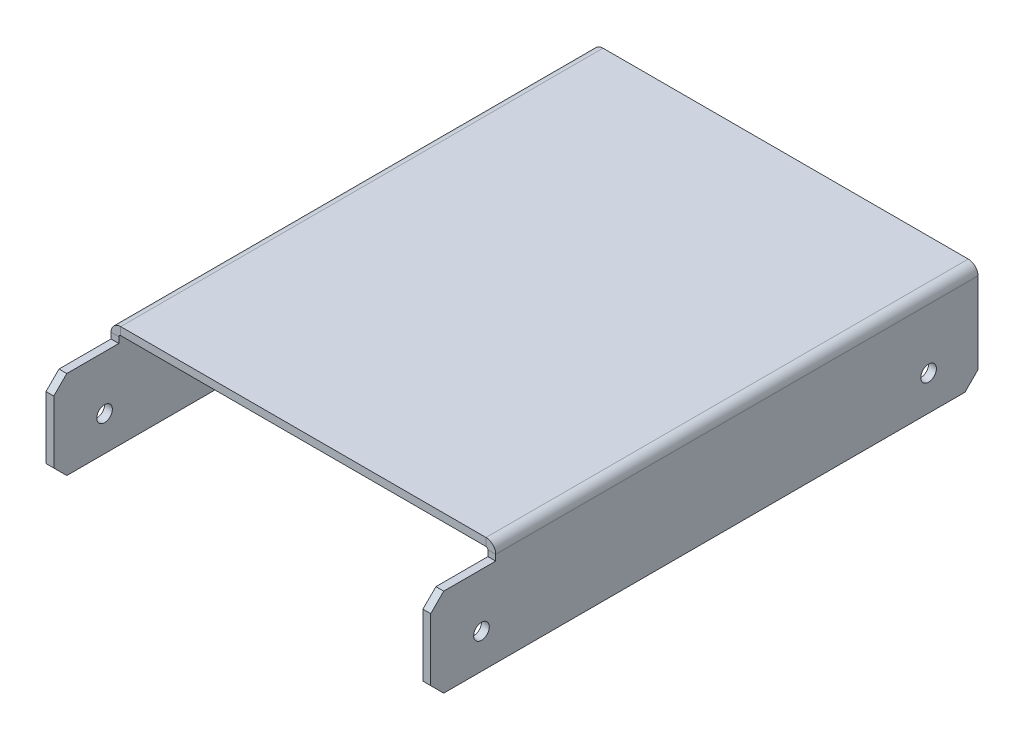
from build123d import *

# Parameters (mm, degrees)
SKETCH18_W                     = 148
SKETCH18_H                     = 205.5334
BASE_FLANGE1_DEPTH             = 3
EDGE_FLANGE1_STRIP_W           = 13.4732
EDGE_FLANGE1_STRIP_H           = 3
EDGE_FLANGE1_STRIP_CUT_DEPTH   = 205.5334
EDGE_FLANGE1_STRIP_2_W         = 13.4732
EDGE_FLANGE1_STRIP_2_H         = 3
EDGE_FLANGE1_STRIP_CUT_2_DEPTH = 205.5334
EDGE_FLANGE1_DEPTH             = 205.5334
EDGE_FLANGE1_BEND_DEPTH        = 205.5334
SKETCH27_R                     = 3
CUT_EXTRUDE1_DEPTH             = 227.212201998
SKETCH28_W                     = 160
SKETCH28_H                     = 8
CUT_EXTRUDE2_DEPTH             = 25
BOSS_EXTRUDE1_DEPTH            = 5
CHAMFER2_SIZE                  = 5


# Sheet-metal steps are written as plain solids
with BuildPart() as part:
    # Sketch18 → Base-Flange1 (new body)
    with BuildSketch(Plane(origin=(0, 0, 0), x_dir=(1, 0, 0), z_dir=(0, 1, 0))):
        with Locations((-74, -63.57018807)):
            Rectangle(SKETCH18_W, SKETCH18_H)
    extrude(amount=-BASE_FLANGE1_DEPTH)

    # Edge-Flange1 strip (across the edge) → Edge-Flange1 strip cut (cut)
    with BuildSketch(Plane(origin=(0, -3, -39.19651193), x_dir=(-1, 0, 0), z_dir=(0, 0, 1))):
        with Locations((-3, -1.5)):
            Rectangle(EDGE_FLANGE1_STRIP_W, EDGE_FLANGE1_STRIP_H)
    extrude(amount=EDGE_FLANGE1_STRIP_CUT_DEPTH, mode=Mode.SUBTRACT)

    # Edge-Flange1 strip 2 (across the edge) → Edge-Flange1 strip cut 2 (cut)
    with BuildSketch(Plane(origin=(-148, -3, 166.33688807), x_dir=(1, 0, 0), z_dir=(0, 0, -1))):
        with Locations((-3, -1.5)):
            Rectangle(EDGE_FLANGE1_STRIP_2_W, EDGE_FLANGE1_STRIP_2_H)
    extrude(amount=EDGE_FLANGE1_STRIP_CUT_2_DEPTH, mode=Mode.SUBTRACT)

    # Edge-Flange1 section (across the edge) → Edge-Flange1 (add)
    with BuildSketch(Plane(origin=(0, -3, -39.19651193), x_dir=(-1, 0, 0), z_dir=(0, 0, 1))):
        with BuildLine():
            Line((0, 0.7366), (0, 37))
            Line((0, 37), (3, 37))
            Line((3, 37), (3, 0.7366))
            ThreePointArc((3, 0.7366), (3.215745145, 0.215745145), (3.7366, 0))
            Line((3.7366, 0), (3.7366, -3))
            ThreePointArc((3.7366, -3), (1.094424801, -1.905575199), (0, 0.7366))
        make_face()
    extrude(amount=EDGE_FLANGE1_DEPTH)

    # Edge-Flange1 section 2 (across the edge) → Edge-Flange1 bend (add)
    with BuildSketch(Plane(origin=(-148, -3, 166.33688807), x_dir=(1, 0, 0), z_dir=(0, 0, -1))):
        with BuildLine():
            Line((0, 0.7366), (0, 37))
            Line((0, 37), (3, 37))
            Line((3, 37), (3, 0.7366))
            ThreePointArc((3, 0.7366), (3.215745145, 0.215745145), (3.7366, 0))
            Line((3.7366, 0), (3.7366, -3))
            ThreePointArc((3.7366, -3), (1.094424801, -1.905575199), (0, 0.7366))
        make_face()
    extrude(amount=EDGE_FLANGE1_BEND_DEPTH)

    # Sketch27 → Cut-Extrude1 (cut, through all)
    with BuildSketch(Plane.ZY.offset(148)):
        with Locations(Location((-25.19651193, -26.64, 0), (0, 0, 270))):
            Circle(SKETCH27_R)
        with Locations(Location((146.80688807, -26.64, 0), (0, 0, 270))):
            Circle(SKETCH27_R)
    extrude(amount=-CUT_EXTRUDE1_DEPTH, mode=Mode.SUBTRACT)

    # Sketch28 → Cut-Extrude2 (cut)
    with BuildSketch(Plane.XY.offset(166.33688807)):
        with Locations((-79, -2)):
            Rectangle(SKETCH28_W, SKETCH28_H)
    extrude(amount=-CUT_EXTRUDE2_DEPTH, mode=Mode.SUBTRACT)

    # Sketch32 → Boss-Extrude1 (add)
    with BuildSketch(Plane(origin=(0, 0, -39.19651193), x_dir=(-1, 0, 0), z_dir=(0, 0, -1))):
        with BuildLine():
            Line((0, -3.7366), (0, -40))
            Line((0, -40), (3, -40))
            Line((3, -40), (3, -3.7366))
            ThreePointArc((3, -3.7366), (3.215745145, -3.215745145), (3.7366, -3))
            Line((3.7366, -3), (144.2634, -3))
            ThreePointArc((144.2634, -3), (144.784254855, -3.215745145), (145, -3.7366))
            Line((145, -3.7366), (145, -40))
            Line((145, -40), (148, -40))
            Line((148, -40), (148, -3.7366))
            ThreePointArc((148, -3.7366), (146.905575199, -1.094424801), (144.2634, 0))
            Line((144.2634, 0), (3.7366, 0))
            ThreePointArc((3.7366, 0), (1.094424801, -1.094424801), (0, -3.7366))
        make_face()
    extrude(amount=BOSS_EXTRUDE1_DEPTH)

    # Chamfer2
    chamfer2_edges = [part.edges().sort_by_distance(p)[0] for p in [
        (-1.5, -6, 166.33688807),
        (-146.5, -6, 166.33688807),
        (-146.5, -40, -44.19651193),
        (-1.5, -40, -44.19651193),
        (-1.5, -40, 166.33688807),
        (-146.5, -40, 166.33688807),
    ]]
    chamfer(chamfer2_edges, length=CHAMFER2_SIZE)


solid = part.part
